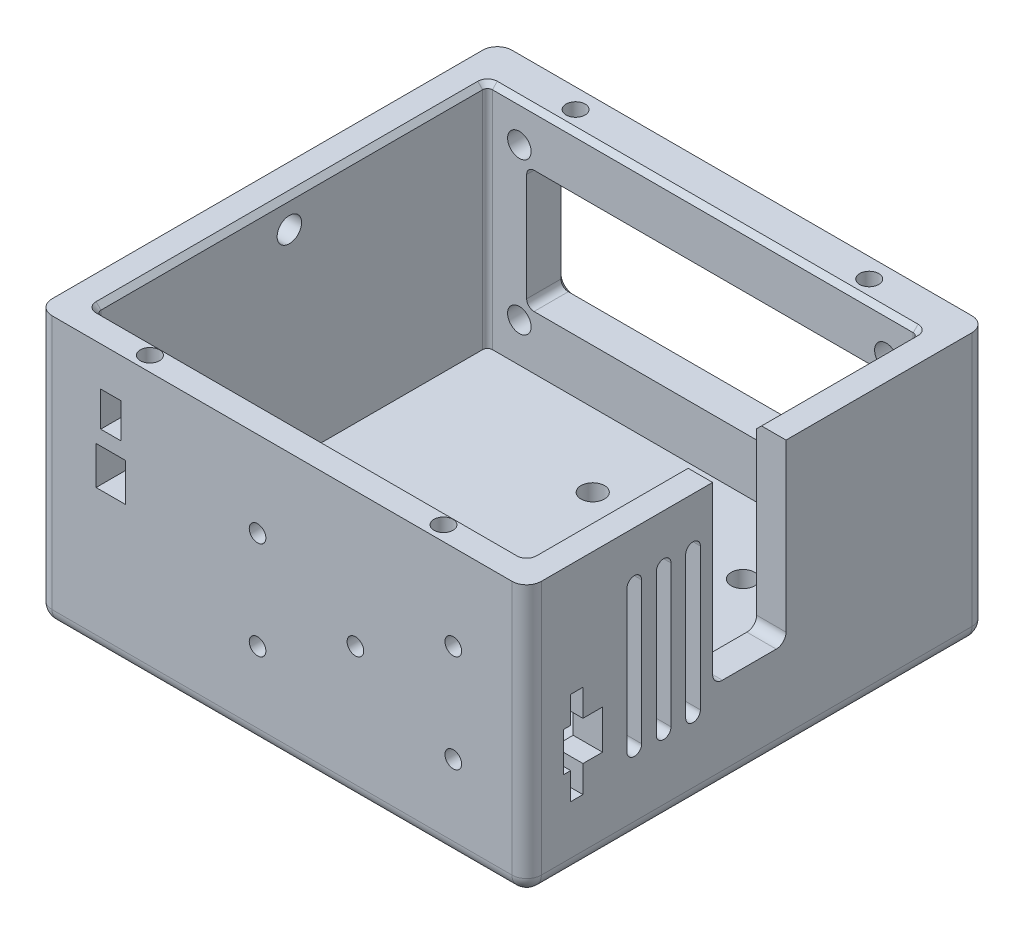
from build123d import *

# Parameters (mm, degrees)
SKETCH_1_W                                          = 100
SKETCH_1_H                                          = 94
EXTRUDE_1_DEPTH                                     = 55
SHELL_1_T                                           = -6
SHELL_1_THICKNESS_2_FACE_W                          = 88
SHELL_1_THICKNESS_2_FACE_H                          = 49
SHELL_1_THICKNESS_2_DEPTH                           = 2
SHELL_1_THICKNESS_3_FACE_W                          = 80
SHELL_1_THICKNESS_3_FACE_H                          = 88
SHELL_1_THICKNESS_3_DEPTH                           = 2
SKETCH_2_R                                          = 5.1
CUT_EXTRUDE_1_DEPTH                                 = 119.617030818
SKETCH_8_R                                          = 2.5
CUT_EXTRUDE_2_DEPTH                                 = 124.426091245
CBORE_FOR_M3_HEX_SOCKET_HEAD_CAP_SCREW3_D           = 3.4
CBORE_FOR_M3_HEX_SOCKET_HEAD_CAP_SCREW3_DEPTH       = 6
CBORE_FOR_M3_HEX_SOCKET_HEAD_CAP_SCREW3_CBORE_D     = 6.5
CBORE_FOR_M3_HEX_SOCKET_HEAD_CAP_SCREW3_CBORE_DEPTH = 3
CUT_EXTRUDE_3_DEPTH                                 = 84.174515328
CUT_EXTRUDE_3_DEPTH_BACK                            = 84.174515328
SKETCH_19_W                                         = 6
SKETCH_19_H                                         = 7.8
SKETCH_19_W_2                                       = 4.1
SKETCH_19_H_2                                       = 7.1
CUT_EXTRUDE_4_DEPTH                                 = 116.191145493
CBORE_FOR_M3_HEX_SOCKET_HEAD_CAP_SCREW2_D           = 3.4
CBORE_FOR_M3_HEX_SOCKET_HEAD_CAP_SCREW2_DEPTH       = 6
CBORE_FOR_M3_HEX_SOCKET_HEAD_CAP_SCREW2_CBORE_D     = 6.5
CBORE_FOR_M3_HEX_SOCKET_HEAD_CAP_SCREW2_CBORE_DEPTH = 3.4
SKETCH_23_R                                         = 3.45
CUT_EXTRUDE_6_DEPTH                                 = 119.617030818
SKETCH_33_W                                         = 12
SKETCH_33_H                                         = 14
CUT_EXTRUDE_16_DEPTH                                = 3.5
SKETCH_26_W                                         = 2
SKETCH_26_H                                         = 1.5
CUT_EXTRUDE_9_DEPTH                                 = 1
CUT_EXTRUDE_11_DEPTH                                = 119.617030818
CUT_EXTRUDE_12_REACH                                = 121.837
SKETCH_29_W                                         = 72
SKETCH_29_H                                         = 25
SKETCH_22_R                                         = 2.4
CUT_EXTRUDE_5_DEPTH                                 = 8
SKETCH_32_R                                         = 1.95
CUT_EXTRUDE_15_DEPTH                                = 4.2
CHAMFER_2_SIZE                                      = 1
CHAMFER_1_SIZE                                      = 1
FILLET1_R                                           = 1.5
FILLET3_R                                           = 1
FILLET4_R                                           = 3
CHAMFER1_SIZE                                       = 1
CHAMFER2_SIZE                                       = 1
SKETCH3_W                                           = 2.5
SKETCH3_H                                           = 5.5
SKETCH3_W_2                                         = 4
SKETCH3_H_2                                         = 8
SKETCH3_W_3                                         = 1.5
CUT_EXTRUDE1_DEPTH                                  = 6
SKETCH4_W                                           = 39
SKETCH4_H                                           = 39
CUT_EXTRUDE2_DEPTH                                  = 0.5
CUT_EXTRUDE3_START                                  = -6
SKETCH6_W                                           = 15
SKETCH6_H                                           = 36
CUT_EXTRUDE3_DEPTH                                  = 6
FILLET5_R                                           = 2
CUT_EXTRUDE4_DEPTH                                  = 4
CUT_EXTRUDE5_REACH                                  = 89.943
CBORE_START                                         = 4.6
CBORE_SLOT_FOR_M3_HEX_SOCKET_HEAD_CAP_SC_DEPTH      = 3.4
CBORE_START_2                                       = 0.5
CBORE_SLOT_FOR_M3_HEX_SOCKET_HEAD_CA_3_DEPTH        = 4.1
F_4_8_4_8_DIAMETER_HOLE1_D                          = 4.8


# Read off the part's stored shape, not the designer's step: CBORE SLOT for M3 Hex Socket Head Cap Screw1
with BuildPart() as part:
    # 草圖1 → 填料-伸長1 (new body)
    with BuildSketch(Plane(origin=(0, 0, 0), x_dir=(1, 0, 0), z_dir=(0, 1, 0))):
        Rectangle(SKETCH_1_W, SKETCH_1_H)
    extrude(amount=EXTRUDE_1_DEPTH)

    # 薄殼1
    shell_1_openings = [part.faces().sort_by_distance(p)[0] for p in [
        (0, 55, 0),
    ]]
    offset(amount=SHELL_1_T, openings=shell_1_openings, kind=Kind.INTERSECTION)

    # 薄殼1 thickness 2 face (on inner face of the shell) → 薄殼1 thickness 2 (add)
    with BuildSketch(Plane(origin=(0, 30.5, -41), x_dir=(-1, 0, 0), z_dir=(0, 0, -1))):
        Rectangle(SHELL_1_THICKNESS_2_FACE_W, SHELL_1_THICKNESS_2_FACE_H)
    extrude(amount=-SHELL_1_THICKNESS_2_DEPTH)

    # 薄殼1 thickness 3 face (on inner face of the shell) → 薄殼1 thickness 3 (add)
    with BuildSketch(Plane(origin=(0, 6, 1), x_dir=(0, 0, -1), z_dir=(0, -1, 0))):
        Rectangle(SHELL_1_THICKNESS_3_FACE_W, SHELL_1_THICKNESS_3_FACE_H)
    extrude(amount=-SHELL_1_THICKNESS_3_DEPTH)

    # 草圖2 → 除料-伸長1 (cut, through all)
    with BuildSketch(Plane.ZY.offset(-44)):
        with Locations((1.5, 29)):
            Circle(SKETCH_2_R)
    extrude(amount=-CUT_EXTRUDE_1_DEPTH, mode=Mode.SUBTRACT)

    # 草圖8 → 除料-伸長2 (cut, through all)
    with BuildSketch(Plane(origin=(50, 0, 0), x_dir=(0, 0, -1), z_dir=(1, 0, 0))):
        with Locations((-1.5, 49)):
            Circle(SKETCH_8_R)
    extrude(amount=-CUT_EXTRUDE_2_DEPTH, mode=Mode.SUBTRACT)

    # CBORE for M3 Hex Socket Head Cap Screw3
    with Locations(Plane(origin=(0, 0, 41), x_dir=(-1, 0, 0), z_dir=(0, 0, -1))):
        with Locations((5, 37.5), (5, 17.5), (-35, 17.5), (-35, 37.5)):
            CounterBoreHole(CBORE_FOR_M3_HEX_SOCKET_HEAD_CAP_SCREW3_D / 2, CBORE_FOR_M3_HEX_SOCKET_HEAD_CAP_SCREW3_CBORE_D / 2, CBORE_FOR_M3_HEX_SOCKET_HEAD_CAP_SCREW3_CBORE_DEPTH, depth=CBORE_FOR_M3_HEX_SOCKET_HEAD_CAP_SCREW3_DEPTH)

    # 草圖16 → 除料-伸長3 (cut, two sides: drawn at the far end of the back side and taken through both)
    with BuildSketch(Plane(origin=(0, 8, 0), x_dir=(1, 0, 0), z_dir=(0, 1, 0)).offset(-CUT_EXTRUDE_3_DEPTH_BACK)):
        with BuildLine():
            Line((7, -31), (19, -31))
            ThreePointArc((19, -31), (22, -34), (19, -37))
            Line((19, -37), (7, -37))
            ThreePointArc((7, -37), (4, -34), (7, -31))
        make_face()
    extrude(amount=CUT_EXTRUDE_3_DEPTH + CUT_EXTRUDE_3_DEPTH_BACK, mode=Mode.SUBTRACT)

    # 草圖19 → 除料-伸長4 (cut, through all)
    with BuildSketch(Plane(origin=(0, 0, 41), x_dir=(-1, 0, 0), z_dir=(0, 0, -1))):
        with Locations((35, 33)):
            Rectangle(SKETCH_19_W, SKETCH_19_H)
        with Locations((35, 43.45)):
            Rectangle(SKETCH_19_W_2, SKETCH_19_H_2)
    extrude(amount=-CUT_EXTRUDE_4_DEPTH, mode=Mode.SUBTRACT)

    # CBORE for M3 Hex Socket Head Cap Screw2
    with Locations(Plane(origin=(0, 0, 41), x_dir=(-1, 0, 0), z_dir=(0, 0, -1))):
        with Locations((-15, 27.5)):
            CounterBoreHole(CBORE_FOR_M3_HEX_SOCKET_HEAD_CAP_SCREW2_D / 2, CBORE_FOR_M3_HEX_SOCKET_HEAD_CAP_SCREW2_CBORE_D / 2, CBORE_FOR_M3_HEX_SOCKET_HEAD_CAP_SCREW2_CBORE_DEPTH, depth=CBORE_FOR_M3_HEX_SOCKET_HEAD_CAP_SCREW2_DEPTH)

    # 草圖23 → 除料-伸長6 (cut, through all)
    with BuildSketch(Plane(origin=(-44, 0, 0), x_dir=(0, 0, -1), z_dir=(1, 0, 0))):
        with Locations((-26, 22.5)):
            Circle(SKETCH_23_R)
    extrude(amount=-CUT_EXTRUDE_6_DEPTH, mode=Mode.SUBTRACT)

    # 草圖33 → 除料-伸長16 (cut)
    with BuildSketch(Plane(origin=(-44, 0, 0), x_dir=(0, 0, -1), z_dir=(1, 0, 0))):
        with Locations((-26, 22.5)):
            Rectangle(SKETCH_33_W, SKETCH_33_H)
    extrude(amount=-CUT_EXTRUDE_16_DEPTH, mode=Mode.SUBTRACT)

    # 草圖26 → 除料-伸長9 (cut)
    with BuildSketch(Plane(origin=(-47.5, 0, 0), x_dir=(0, 0, -1), z_dir=(1, 0, 0))):
        with Locations((-26, 28.75)):
            Rectangle(SKETCH_26_W, SKETCH_26_H)
    extrude(amount=-CUT_EXTRUDE_9_DEPTH, mode=Mode.SUBTRACT)

    # 草圖28 → 除料-伸長11 (cut, through all)
    with BuildSketch(Plane.ZY.offset(-44)):
        with BuildLine():
            Line((11.5, 16), (11.5, 45))
            ThreePointArc((11.5, 45), (13, 46.5), (14.5, 45))
            Line((14.5, 45), (14.5, 16))
            ThreePointArc((14.5, 16), (13, 14.5), (11.5, 16))
        make_face()
        with BuildLine():
            Line((17.5, 16), (17.5, 45))
            ThreePointArc((17.5, 45), (19, 46.5), (20.5, 45))
            Line((20.5, 45), (20.5, 16))
            ThreePointArc((20.5, 16), (19, 14.5), (17.5, 16))
        make_face()
        with BuildLine():
            Line((23.5, 16), (23.5, 45))
            ThreePointArc((23.5, 45), (25, 46.5), (26.5, 45))
            Line((26.5, 45), (26.5, 16))
            ThreePointArc((26.5, 16), (25, 14.5), (23.5, 16))
        make_face()
    extrude(amount=-CUT_EXTRUDE_11_DEPTH, mode=Mode.SUBTRACT)

    # 草圖29 → 除料-伸長12 (cut, up to next)
    with BuildSketch(Plane(origin=(0, 0, -47), x_dir=(-1, 0, 0), z_dir=(0, 0, -1)), mode=Mode.PRIVATE) as cut_extrude_12_sk1:
        with Locations((0, 31.5)):
            Rectangle(SKETCH_29_W, SKETCH_29_H)
    cut_extrude_12_tool1 = extrude(cut_extrude_12_sk1.sketch, amount=-CUT_EXTRUDE_12_REACH, mode=Mode.PRIVATE) & part.part
    add(cut_extrude_12_tool1.solids().sort_by_distance((0, 31.5, -47))[0], mode=Mode.SUBTRACT)

    # 草圖22 → 除料-伸長5 (cut)
    with BuildSketch(Plane(origin=(0, 0, -47), x_dir=(-1, 0, 0), z_dir=(0, 0, -1))):
        with Locations((37.5, 16)):
            Circle(SKETCH_22_R)
        with Locations((-37.5, 16)):
            Circle(SKETCH_22_R)
        with Locations((-37.5, 47)):
            Circle(SKETCH_22_R)
        with Locations((37.5, 47)):
            Circle(SKETCH_22_R)
    extrude(amount=-CUT_EXTRUDE_5_DEPTH, mode=Mode.SUBTRACT)

    # 草圖32 → 除料-伸長15 (cut)
    with BuildSketch(Plane(origin=(0, 55, 0), x_dir=(1, 0, 0), z_dir=(0, 1, 0))):
        with Locations(Location((-30, 43, 0), (0, 0, 90))):
            Circle(SKETCH_32_R)
        with Locations(Location((30, 43, 0), (0, 0, 270))):
            Circle(SKETCH_32_R)
        with Locations(Location((30, -44, 0), (0, 0, 90))):
            Circle(SKETCH_32_R)
        with Locations(Location((-30, -44, 0), (0, 0, 270))):
            Circle(SKETCH_32_R)
    extrude(amount=-CUT_EXTRUDE_15_DEPTH, mode=Mode.SUBTRACT)

    # 導角2
    chamfer_2_edges = [part.edges().sort_by_distance(p)[0] for p in [
        (50, 29, -3.6),
        (44, 29, -3.6),
    ]]
    chamfer(chamfer_2_edges, length=CHAMFER_2_SIZE)

    # 導角1
    chamfer_1_edges = [part.edges().sort_by_distance(p)[0] for p in [
        (13, 8, 37),
        (22, 8, 34),
        (13, 8, 31),
        (4, 8, 34),
        (4, 0, 34),
        (13, 0, 31),
        (22, 0, 34),
        (13, 0, 37),
    ]]
    chamfer(chamfer_1_edges, length=CHAMFER_1_SIZE)

    # Fillet1
    fillet1_edges = [part.edges().sort_by_distance(p)[0] for p in [
        (36, 19, -43),
        (36, 44, -43),
        (-36, 44, -43),
        (-36, 19, -43),
    ]]
    fillet(fillet1_edges, radius=FILLET1_R)

    # Fillet3
    fillet3_edges = [part.edges().sort_by_distance(p)[0] for p in [
        (44, 31.5, 41),
        (44, 31.5, -39),
        (-44, 31.5, -39),
        (-44, 31.5, 41),
    ]]
    fillet(fillet3_edges, radius=FILLET3_R)

    # Fillet4
    fillet4_edges = [part.edges().sort_by_distance(p)[0] for p in [
        (0, 0, 47),
        (-50, 0, 0),
        (0, 0, -47),
        (50, 0, 0),
        (50, 27.5, 47),
        (-50, 27.5, 47),
        (-50, 27.5, -47),
        (50, 27.5, -47),
    ]]
    fillet(fillet4_edges, radius=FILLET4_R)

    # Chamfer1
    chamfer1_edges = [part.edges().sort_by_distance(p)[0] for p in [
        (-44, 55, 1),
        (0, 55, 41),
        (44, 55, 1),
        (0, 55, -39),
        (-43.707106781, 55, 40.707106781),
        (43.707106781, 55, 40.707106781),
        (43.707106781, 55, -38.707106781),
        (-43.707106781, 55, -38.707106781),
    ]]
    chamfer(chamfer1_edges, length=CHAMFER1_SIZE)

    # Chamfer2
    chamfer2_edges = [part.edges().sort_by_distance(p)[0] for p in [
        (0, 44, -47),
        (-36, 31.5, -47),
        (36, 31.5, -47),
        (0, 19, -47),
        (-35.560660172, 43.560660172, -47),
        (35.560660172, 43.560660172, -47),
        (35.560660172, 19.439339828, -47),
        (-35.560660172, 19.439339828, -47),
    ]]
    chamfer(chamfer2_edges, length=CHAMFER2_SIZE)

    # Sketch3 → Cut-Extrude1 (cut)
    with BuildSketch(Plane.ZY.offset(-44)):
        with Locations((36.75, 15.75)):
            Rectangle(SKETCH3_W, SKETCH3_H)
        with Locations((33.5, 22.5)):
            Rectangle(SKETCH3_W_2, SKETCH3_H_2)
        with Locations((36.75, 22.5)):
            Rectangle(SKETCH3_W, SKETCH3_H_2)
        with Locations((38.75, 22.5)):
            Rectangle(SKETCH3_W_3, SKETCH3_H_2)
        with Locations((36.75, 29.25)):
            Rectangle(SKETCH3_W, SKETCH3_H)
    extrude(amount=-CUT_EXTRUDE1_DEPTH, mode=Mode.SUBTRACT)

    # Sketch4 → Cut-Extrude2 (cut)
    with BuildSketch(Plane(origin=(0, 0, 0), x_dir=(-1, 0, 0), z_dir=(0, -1, 0))):
        with Locations((20, -20.5)):
            Rectangle(SKETCH4_W, SKETCH4_H)
    extrude(amount=-CUT_EXTRUDE2_DEPTH, mode=Mode.SUBTRACT)

    # Sketch6 → Cut-Extrude3 (cut)
    with BuildSketch(Plane(origin=(50, 0, 0), x_dir=(0, 0, -1), z_dir=(1, 0, 0)).offset(CUT_EXTRUDE3_START)):
        with Locations((-1.5, 37)):
            Rectangle(SKETCH6_W, SKETCH6_H)
    extrude(amount=CUT_EXTRUDE3_DEPTH, mode=Mode.SUBTRACT)

    # Fillet5
    fillet5_edges = [part.edges().sort_by_distance(p)[0] for p in [
        (47, 19, 9),
        (47, 19, -6),
    ]]
    fillet(fillet5_edges, radius=FILLET5_R)

    # Sketch8 → Cut-Extrude4 (cut)
    with BuildSketch(Plane.XZ):
        with BuildLine():
            Line((-9, 21.5), (-9, 19.5))
            ThreePointArc((-9, 19.5), (-20, 8.5), (-31, 19.5))
            Line((-31, 19.5), (-31, 21.5))
            ThreePointArc((-31, 21.5), (-20, 32.5), (-9, 21.5))
        make_face()
    extrude(amount=-CUT_EXTRUDE4_DEPTH, mode=Mode.SUBTRACT)

    # Sketch10 → Cut-Extrude5 (cut, up to next)
    with BuildSketch(Plane.XZ, mode=Mode.PRIVATE) as cut_extrude5_sk1:
        with BuildLine():
            Line((-16.75, 21.5), (-16.75, 19.5))
            ThreePointArc((-16.75, 19.5), (-20, 16.25), (-23.25, 19.5))
            Line((-23.25, 19.5), (-23.25, 21.5))
            ThreePointArc((-23.25, 21.5), (-20, 24.75), (-16.75, 21.5))
        make_face()
    cut_extrude5_tool1 = extrude(cut_extrude5_sk1.sketch, amount=-CUT_EXTRUDE5_REACH, mode=Mode.PRIVATE) & part.part
    add(cut_extrude5_tool1.solids().sort_by_distance((-20, 0, 20.5))[0], mode=Mode.SUBTRACT)

    # CBORE SLOT for M3 Hex Socket Head Ca 2 → CBORE SLOT for M3 Hex Socket Head Cap Screw1 (cut)
    with BuildSketch(Plane(origin=(0, 0, 0), x_dir=(1, 0, 0), z_dir=(0, 1, 0)).offset(CBORE_START)):
        with BuildLine():
            Line((-29.75, -34.4), (-29.75, -32.6))
            ThreePointArc((-29.75, -32.6), (-33, -29.35), (-36.25, -32.6))
            Line((-36.25, -32.6), (-36.25, -34.4))
            ThreePointArc((-36.25, -34.4), (-33, -37.65), (-29.75, -34.4))
        make_face()
        with BuildLine():
            ThreePointArc((-29.75, -6.6), (-33, -3.35), (-36.25, -6.6))
            Line((-36.25, -6.6), (-36.25, -8.4))
            ThreePointArc((-36.25, -8.4), (-33, -11.65), (-29.75, -8.4))
            Line((-29.75, -8.4), (-29.75, -6.6))
        make_face()
        with BuildLine():
            Line((-3.75, -34.4), (-3.75, -32.6))
            ThreePointArc((-3.75, -32.6), (-7, -29.35), (-10.25, -32.6))
            Line((-10.25, -32.6), (-10.25, -34.4))
            ThreePointArc((-10.25, -34.4), (-7, -37.65), (-3.75, -34.4))
        make_face()
    extrude(amount=CBORE_SLOT_FOR_M3_HEX_SOCKET_HEAD_CAP_SC_DEPTH, mode=Mode.SUBTRACT)

    # CBORE SLOT for M3 Hex Socket Head Ca 3 o → CBORE SLOT for M3 Hex Socket Head Ca 3 (cut)
    with BuildSketch(Plane(origin=(0, 0, 0), x_dir=(1, 0, 0), z_dir=(0, 1, 0)).offset(CBORE_START_2)):
        with BuildLine():
            Line((-31.4, -34.4), (-31.4, -32.6))
            ThreePointArc((-31.4, -32.6), (-33, -31), (-34.6, -32.6))
            Line((-34.6, -32.6), (-34.6, -34.4))
            ThreePointArc((-34.6, -34.4), (-33, -36), (-31.4, -34.4))
        make_face()
        with BuildLine():
            ThreePointArc((-31.4, -6.6), (-33, -5), (-34.6, -6.6))
            Line((-34.6, -6.6), (-34.6, -8.4))
            ThreePointArc((-34.6, -8.4), (-33, -10), (-31.4, -8.4))
            Line((-31.4, -8.4), (-31.4, -6.6))
        make_face()
        with BuildLine():
            Line((-8.6, -32.6), (-8.6, -34.4))
            ThreePointArc((-8.6, -34.4), (-7, -36), (-5.4, -34.4))
            Line((-5.4, -34.4), (-5.4, -32.6))
            ThreePointArc((-5.4, -32.6), (-7, -31), (-8.6, -32.6))
        make_face()
    extrude(amount=CBORE_SLOT_FOR_M3_HEX_SOCKET_HEAD_CA_3_DEPTH, mode=Mode.SUBTRACT)

    # Ø4.8 (4.8) Diameter Hole1 (through all)
    with Locations(Plane(origin=(0, 8, 0), x_dir=(1, 0, 0), z_dir=(0, 1, 0))):
        with Locations((-7.5, 24), (23.2, 24), (-7.5, -27), (23.2, -25)):
            Hole(F_4_8_4_8_DIAMETER_HOLE1_D / 2)


solid = part.part
